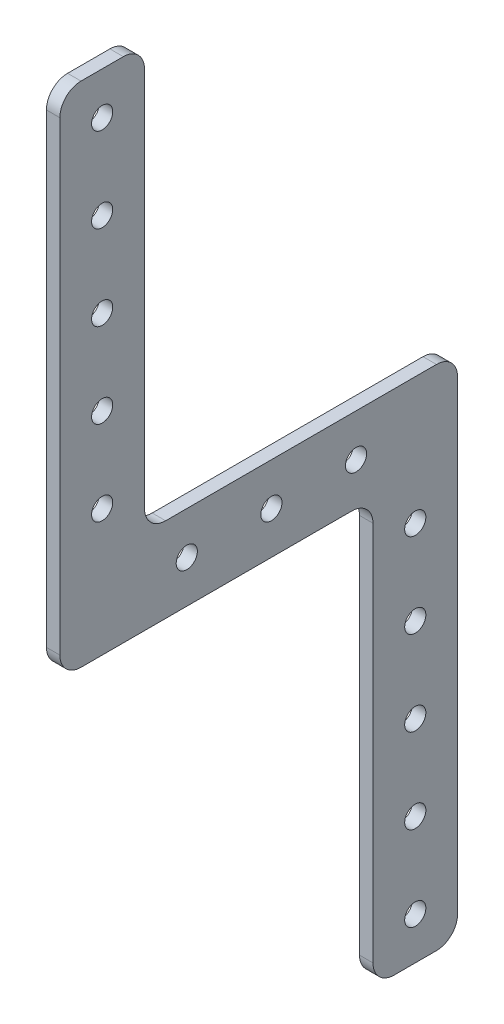
from build123d import *

# Parameters (mm, degrees)
SKETCH2_R           = 2.5
BOSS_EXTRUDE1_DEPTH = 3.175
FILLET1_R           = 5


with BuildPart() as part:
    # Sketch2 → Boss-Extrude1 (new body)
    with BuildSketch(Plane(origin=(0, 0, 0), x_dir=(0, 0, -1), z_dir=(1, 0, 0))):
        Polygon((-47, 110), (-27, 110), (-27, 10), (47, 10), (47, -110), (27, -110), (27, -10), (-47, -10), align=None)
        with Locations((-37, 100)):
            Circle(SKETCH2_R, mode=Mode.SUBTRACT)
        with Locations((-37, 80)):
            Circle(SKETCH2_R, mode=Mode.SUBTRACT)
        with Locations((-37, 60)):
            Circle(SKETCH2_R, mode=Mode.SUBTRACT)
        with Locations((-37, 40)):
            Circle(SKETCH2_R, mode=Mode.SUBTRACT)
        with Locations((-37, 20)):
            Circle(SKETCH2_R, mode=Mode.SUBTRACT)
        with Locations((37, -100)):
            Circle(SKETCH2_R, mode=Mode.SUBTRACT)
        with Locations((37, -80)):
            Circle(SKETCH2_R, mode=Mode.SUBTRACT)
        with Locations((37, -60)):
            Circle(SKETCH2_R, mode=Mode.SUBTRACT)
        with Locations((37, -40)):
            Circle(SKETCH2_R, mode=Mode.SUBTRACT)
        with Locations((37, -20)):
            Circle(SKETCH2_R, mode=Mode.SUBTRACT)
        with Locations((-17, 0)):
            Circle(SKETCH2_R, mode=Mode.SUBTRACT)
        with Locations((3, 0)):
            Circle(SKETCH2_R, mode=Mode.SUBTRACT)
        with Locations((23, 0)):
            Circle(SKETCH2_R, mode=Mode.SUBTRACT)
    extrude(amount=BOSS_EXTRUDE1_DEPTH)

    # Fillet1
    fillet1_edges = [part.edges().sort_by_distance(p)[0] for p in [
        (1.5875, -110, -47),
        (1.5875, -110, -27),
        (1.5875, -10, -27),
        (1.5875, 10, -47),
        (1.5875, 10, 27),
        (1.5875, -10, 47),
        (1.5875, 110, 27),
        (1.5875, 110, 47),
    ]]
    fillet(fillet1_edges, radius=FILLET1_R)


solid = part.part
